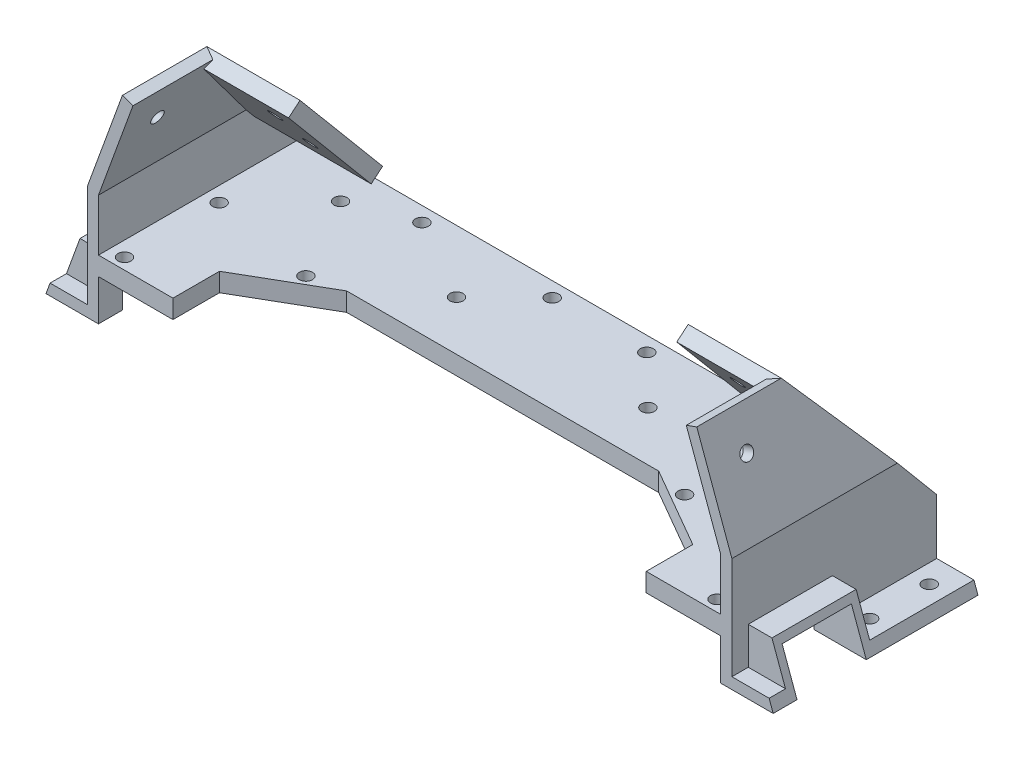
from build123d import *

# Parameters (mm, degrees)
BOSS_EXTRUDE1_DEPTH                 = 30
BOSS_EXTRUDE2_DEPTH                 = 25
CUT_EXTRUDE9_DEPTH                  = 28.6
BOSS_EXTRUDE10_DEPTH                = 4
F_3_5_3_5_DIAMETER_HOLE1_AT_2_COUNT = 2
F_3_5_3_5_DIAMETER_HOLE1_AT_2_PITCH = 14.509439018
F_3_5_3_5_DIAMETER_HOLE2_AT_2_COUNT = 2
F_3_5_3_5_DIAMETER_HOLE2_AT_2_PITCH = 16
F_4_0MM_DOWEL_HOLE1_D               = 3.5
BOSS_EXTRUDE11_DEPTH                = 6.4
F_4_0MM_DOWEL_HOLE2_D               = 3.5
F_4_0MM_DOWEL_HOLE2_DEPTH           = 5
F_3_0MM_DOWEL_HOLE1_D               = 3.5
BOSS_EXTRUDE13_DEPTH                = 5
F_3_0MM_DOWEL_HOLE2_D               = 3.5
F_3_0MM_DOWEL_HOLE2_DEPTH           = 5
BOSS_EXTRUDE14_START                = 28
BOSS_EXTRUDE14_DEPTH                = 22.6
BOSS_EXTRUDE14_2_DEPTH              = 2
BOSS_EXTRUDE14_START_2              = 48.6
BOSS_EXTRUDE14_3_DEPTH              = 2
BOSS_EXTRUDE15_START                = 28
BOSS_EXTRUDE15_DEPTH                = 22.6
BOSS_EXTRUDE15_2_DEPTH              = 2
BOSS_EXTRUDE15_START_2              = 48.6
BOSS_EXTRUDE15_3_DEPTH              = 2
SKETCH54_W                          = 6
SKETCH54_H                          = 11
BOSS_EXTRUDE16_DEPTH                = 3
CUT_EXTRUDE10_DEPTH                 = 3


# Read off the part's stored shape, not the designer's step: Boss-Extrude14, Boss-Extrude15
with BuildPart() as part:
    # Sketch1 → Boss-Extrude1 (new body)
    with BuildSketch(Plane.XY):
        Polygon((-83.548089297, 0), (83.548089297, 0), (83.548089297, -11), (97.64, -11), (96.548089297, -8), (86.548089297, -8), (86.548089297, 19.474774195), (77.1187914, 45.381557247), (74.299713538, 44.355496817), (83.548089297, 18.945793252), (83.548089297, 5), (-83.548089297, 5), (-83.548089297, 18.945793252), (-74.299713538, 44.355496817), (-77.1187914, 45.381557247), (-86.548089297, 19.474774195), (-86.548089297, -8), (-96.548089297, -8), (-97.64, -11), (-83.548089297, -11), align=None)
    extrude(amount=BOSS_EXTRUDE1_DEPTH)

    # Sketch2 → Boss-Extrude2 (add)
    with BuildSketch(Plane.XY.offset(30)):
        Polygon((-77.1187914, 45.381557247), (-74.299713538, 44.355496817), (-83.548089297, 18.945793252), (-83.548089297, 5), (-63.548089297, 5), (-63.548089297, 0), (-86.548089297, 0), (-86.548089297, 19.474774195), align=None)
        Polygon((77.1187914, 45.381557247), (74.299713538, 44.355496817), (83.548089297, 18.945793252), (83.548089297, 5), (63.548089297, 5), (63.548089297, 0), (86.548089297, 0), (86.548089297, 19.474774195), align=None)
    extrude(amount=BOSS_EXTRUDE2_DEPTH)

    # Sketch26 → Cut-Extrude9 (cut)
    with BuildSketch(Plane.ZY.offset(86.548089297)):
        Polygon((0, 45.381557247), (32.311383976, 45.381557247), (0, 6.874349312), align=None)
    cut_extrude9 = extrude(amount=-CUT_EXTRUDE9_DEPTH, mode=Mode.SUBTRACT)

    # Mirror1: Cut-Extrude9 across plane
    add(cut_extrude9.mirror(Plane.ZY), mode=Mode.SUBTRACT)

    # Sketch27 → Boss-Extrude10 (add)
    with BuildSketch(Plane(origin=(0, 2.840315541, -3.38495625), x_dir=(-1, 0, 0), z_dir=(0, 0.6427876096865439, -0.7660444431189742))):
        Polygon((-86.548089297, 21.024208003), (-52.1187914, 21.024208003), (-52.1187914, 55.533647021), (-77.1187914, 55.533647021), align=None)
    boss_extrude10 = extrude(amount=-BOSS_EXTRUDE10_DEPTH)

    # Sketch32 → Ø3.5 (3.5) Diameter Hole1 (revolve, cut)
    with BuildSketch(Plane(origin=(62.1187914, 37.721112816, 25.883507879), x_dir=(0, 0.7660444431189745, 0.6427876096865438), z_dir=(1, 0, 0))):
        Polygon((0, 0), (0, 6.051506083), (1.75, 5), (1.75, 0), align=None)
    f_3_5_3_5_diameter_hole1 = revolve(axis=Axis((62.1187914, 41.802814137, 21.019125665), (0, -0.6427876096865437, 0.7660444431189743)), mode=Mode.SUBTRACT)

    # Ø3.5 (3.5) Diameter Hole1 at 2: Ø3.5 (3.5) Diameter Hole1 ×2
    with Locations(*[Vector(0, -0.7660444431189745, -0.6427876096865437) * (i * F_3_5_3_5_DIAMETER_HOLE1_AT_2_PITCH) for i in range(1, F_3_5_3_5_DIAMETER_HOLE1_AT_2_COUNT)]):
        add(f_3_5_3_5_diameter_hole1, mode=Mode.SUBTRACT)

    # Mirror12: Boss-Extrude10, Ø3.5 (3.5) Diameter Hole1 across plane
    add(boss_extrude10.mirror(Plane.ZY))
    add(f_3_5_3_5_diameter_hole1.mirror(Plane.ZY), mode=Mode.SUBTRACT)

    # Mirror12 copy 1 sketch → Mirror12 copy 1 (revolve, cut)
    with BuildSketch(Plane(origin=(-62.1187914, 26.606237684, 16.557020255), x_dir=(0, 0.7660444431189745, 0.6427876096865438), z_dir=(-1, 0, 0))):
        Polygon((0, 0), (0, -6.051506083), (1.75, -5), (1.75, 0), align=None)
    revolve(axis=Axis((-62.1187914, 30.687939005, 11.692638041), (0, 0.6427876096865437, -0.7660444431189743)), mode=Mode.SUBTRACT)

    # Sketch36 → Ø3.5 (3.5) Diameter Hole2 (revolve, cut)
    with BuildSketch(Plane(origin=(91.548089297, -8, 7), x_dir=(0, 0, 1), z_dir=(1, 0, 0))):
        Polygon((0, 0), (0, 6.051506083), (1.75, 5), (1.75, 0), align=None)
    f_3_5_3_5_diameter_hole2 = revolve(axis=Axis((91.548089297, -1.65, 7), (0, -1, 0)), mode=Mode.SUBTRACT)

    # Ø3.5 (3.5) Diameter Hole2 at 2: Ø3.5 (3.5) Diameter Hole2 ×2
    with Locations(*[(0, 0, i * F_3_5_3_5_DIAMETER_HOLE2_AT_2_PITCH) for i in range(1, F_3_5_3_5_DIAMETER_HOLE2_AT_2_COUNT)]):
        add(f_3_5_3_5_diameter_hole2, mode=Mode.SUBTRACT)

    # Mirror13: Ø3.5 (3.5) Diameter Hole2 across plane
    add(f_3_5_3_5_diameter_hole2.mirror(Plane.ZY), mode=Mode.SUBTRACT)

    # Mirror13 copy 1 sketch → Mirror13 copy 1 (revolve, cut)
    with BuildSketch(Plane(origin=(-91.548089297, -8, 23), x_dir=(0, 0, 1), z_dir=(-1, 0, 0))):
        Polygon((0, 0), (0, -6.051506083), (1.75, -5), (1.75, 0), align=None)
    revolve(axis=Axis((-91.548089297, -1.65, 23), (0, 1, 0)), mode=Mode.SUBTRACT)

    # Sketch37 → Ø3.5 (3.5) Diameter Hole3 (revolve, cut)
    with BuildSketch(Plane(origin=(80.538992834, 35.984631039, 45), x_dir=(-0.342020143325673, 0.9396926207859069, 0), z_dir=(0, 0, 1))):
        Polygon((0, 0), (0, 6.051506083), (1.75, 5), (1.75, 0), align=None)
    f_3_5_3_5_diameter_hole3 = revolve(axis=Axis((86.506040976, 38.156458949, 45), (-0.9396926207859069, -0.34202014332567293, 0)), mode=Mode.SUBTRACT)

    # Mirror14: Ø3.5 (3.5) Diameter Hole3 across plane
    add(f_3_5_3_5_diameter_hole3.mirror(Plane.ZY), mode=Mode.SUBTRACT)

    # Ø4.0mm Dowel Hole1 (through all)
    with Locations(Plane(origin=(0, 5, 0), x_dir=(1, 0, 0), z_dir=(0, 1, 0))):
        with Locations((-12.7, -4), (12.7, -4)):
            Hole(F_4_0MM_DOWEL_HOLE1_D / 2)

    # Sketch44 → Boss-Extrude11 (add)
    with BuildSketch(Plane.XY.offset(55)):
        Polygon((86.548089297, 0), (86.548089297, -8), (96.548089297, -8), (97.64, -11), (86.548089297, -11), (83.548089297, -11), (83.548089297, 5), (86.548089297, 5), align=None)
    boss_extrude11 = extrude(amount=-BOSS_EXTRUDE11_DEPTH)

    # Mirror15: Boss-Extrude11 across plane
    add(boss_extrude11.mirror(Plane.ZY))

    # Ø4.0mm Dowel Hole2
    with Locations(Plane(origin=(0, 5, 0), x_dir=(1, 0, 0), z_dir=(0, 1, 0))):
        with Locations((79.548089297, -52), (79.548089297, -26.6)):
            f_4_0mm_dowel_hole2 = Hole(F_4_0MM_DOWEL_HOLE2_D / 2, depth=F_4_0MM_DOWEL_HOLE2_DEPTH)

    # Ø3.0mm Dowel Hole1 (through all)
    with Locations(Plane(origin=(0, 5, 0), x_dir=(1, 0, 0), z_dir=(0, 1, 0))):
        with Locations((47.7, -4), (25.702954744, -16.7)):
            f_3_0mm_dowel_hole1 = Hole(F_3_0MM_DOWEL_HOLE1_D / 2)

    # Mirror17: Ø4.0mm Dowel Hole2, Ø3.0mm Dowel Hole1 across plane
    add(f_4_0mm_dowel_hole2.mirror(Plane.ZY), mode=Mode.SUBTRACT)
    add(f_3_0mm_dowel_hole1.mirror(Plane.ZY), mode=Mode.SUBTRACT)

    # Sketch49 → Boss-Extrude13 (add)
    with BuildSketch(Plane(origin=(0, 5, 0), x_dir=(1, 0, 0), z_dir=(0, 1, 0))):
        Polygon((-41.897454203, -30), (-63.548089297, -42.5), (-63.548089297, -30), align=None)
    boss_extrude13 = extrude(amount=-BOSS_EXTRUDE13_DEPTH)

    # Mirror18: Boss-Extrude13 across plane
    add(boss_extrude13.mirror(Plane.ZY))

    # Ø3.0mm Dowel Hole2
    with Locations(Plane(origin=(0, 5, 0), x_dir=(1, 0, 0), z_dir=(0, 1, 0))):
        with Locations((-63.548089297, -10), (-50.848089297, -31.997045256)):
            f_3_0mm_dowel_hole2 = Hole(F_3_0MM_DOWEL_HOLE2_D / 2, depth=F_3_0MM_DOWEL_HOLE2_DEPTH)

    # Mirror19: Ø3.0mm Dowel Hole2 across plane
    add(f_3_0mm_dowel_hole2.mirror(Plane.ZY), mode=Mode.SUBTRACT)

    # Boss-Extrude14 outline → Boss-Extrude14 (add)
    with BuildSketch(Plane.XY.offset(BOSS_EXTRUDE14_START)):
        Polygon((93.636327423, 0), (92.908386955, 2), (86.548089297, 2), (86.548089297, 0), align=None)
    extrude(amount=BOSS_EXTRUDE14_DEPTH)

    # Boss-Extrude14 2 outline → Boss-Extrude14 2 (add)
    with BuildSketch(Plane.XY.offset(BOSS_EXTRUDE14_START)):
        Polygon((96.548089297, -8), (93.636327423, 0), (86.548089297, 0), (86.548089297, -8), align=None)
    extrude(amount=BOSS_EXTRUDE14_2_DEPTH)

    # Boss-Extrude14 3 outline → Boss-Extrude14 3 (add)
    with BuildSketch(Plane.XY.offset(BOSS_EXTRUDE14_START_2)):
        Polygon((96.548089297, -8), (93.636327423, 0), (86.548089297, 0), (86.548089297, -8), align=None)
    extrude(amount=BOSS_EXTRUDE14_3_DEPTH)

    # Boss-Extrude15 outline → Boss-Extrude15 (add)
    with BuildSketch(Plane.XY.offset(BOSS_EXTRUDE15_START)):
        Polygon((-86.548089297, 2), (-92.903986965, 2), (-93.631927434, 0), (-86.548089297, 0), align=None)
    extrude(amount=BOSS_EXTRUDE15_DEPTH)

    # Boss-Extrude15 2 outline → Boss-Extrude15 2 (add)
    with BuildSketch(Plane.XY.offset(BOSS_EXTRUDE15_START)):
        Polygon((-86.548089297, 0), (-93.631927434, 0), (-96.543689308, -8), (-86.548089297, -8), align=None)
    extrude(amount=BOSS_EXTRUDE15_2_DEPTH)

    # Boss-Extrude15 3 outline → Boss-Extrude15 3 (add)
    with BuildSketch(Plane.XY.offset(BOSS_EXTRUDE15_START_2)):
        Polygon((-86.548089297, 0), (-93.631927434, 0), (-96.543689308, -8), (-86.548089297, -8), align=None)
    extrude(amount=BOSS_EXTRUDE15_3_DEPTH)

    # Sketch54 → Boss-Extrude16 (add)
    with BuildSketch(Plane(origin=(0, 0, 0), x_dir=(-1, 0, 0), z_dir=(0, 0, -1))):
        with Locations((-63.915800061, -5.5)):
            Rectangle(SKETCH54_W, SKETCH54_H)
    boss_extrude16 = extrude(amount=-BOSS_EXTRUDE16_DEPTH)

    # Sketch55 → Cut-Extrude10 (cut)
    with BuildSketch(Plane(origin=(0, 0, 0), x_dir=(-1, 0, 0), z_dir=(0, 0, -1))):
        with BuildLine():
            Line((-62.415800061, -3), (-62.415800061, -8))
            ThreePointArc((-62.415800061, -8), (-63.915800061, -9.5), (-65.415800061, -8))
            Line((-65.415800061, -8), (-65.415800061, -3))
            ThreePointArc((-65.415800061, -3), (-63.915800061, -1.5), (-62.415800061, -3))
        make_face()
    cut_extrude10 = extrude(amount=-CUT_EXTRUDE10_DEPTH, mode=Mode.SUBTRACT)

    # Mirror20: Boss-Extrude16, Cut-Extrude10 across plane
    add(boss_extrude16.mirror(Plane.ZY))
    add(cut_extrude10.mirror(Plane.ZY), mode=Mode.SUBTRACT)


solid = part.part
